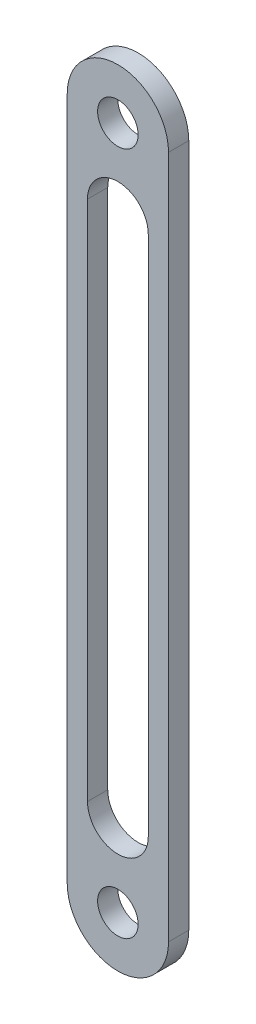
from build123d import *

# Parameters (mm, degrees)
CROQUIS1_R              = 4
SALIENTE_EXTRUIR1_DEPTH = 4


with BuildPart() as part:
    # Croquis1 → Saliente-Extruir1 (new body)
    with BuildSketch(Plane.XY):
        with BuildLine():
            Line((10, 67.5), (10, -67.5))
            ThreePointArc((10, -67.5), (0, -77.5), (-10, -67.5))
            Line((-10, -67.5), (-10, 67.5))
            ThreePointArc((-10, 67.5), (0, 77.5), (10, 67.5))
        make_face()
        with Locations((0, 67.5)):
            Circle(CROQUIS1_R, mode=Mode.SUBTRACT)
        with Locations((0, -67.5)):
            Circle(CROQUIS1_R, mode=Mode.SUBTRACT)
        with BuildLine():
            Line((6, 51.5), (6, -51.5))
            ThreePointArc((6, -51.5), (0, -57.5), (-6, -51.5))
            Line((-6, -51.5), (-6, 51.5))
            ThreePointArc((-6, 51.5), (0, 57.5), (6, 51.5))
        make_face(mode=Mode.SUBTRACT)
    extrude(amount=SALIENTE_EXTRUIR1_DEPTH)


solid = part.part
